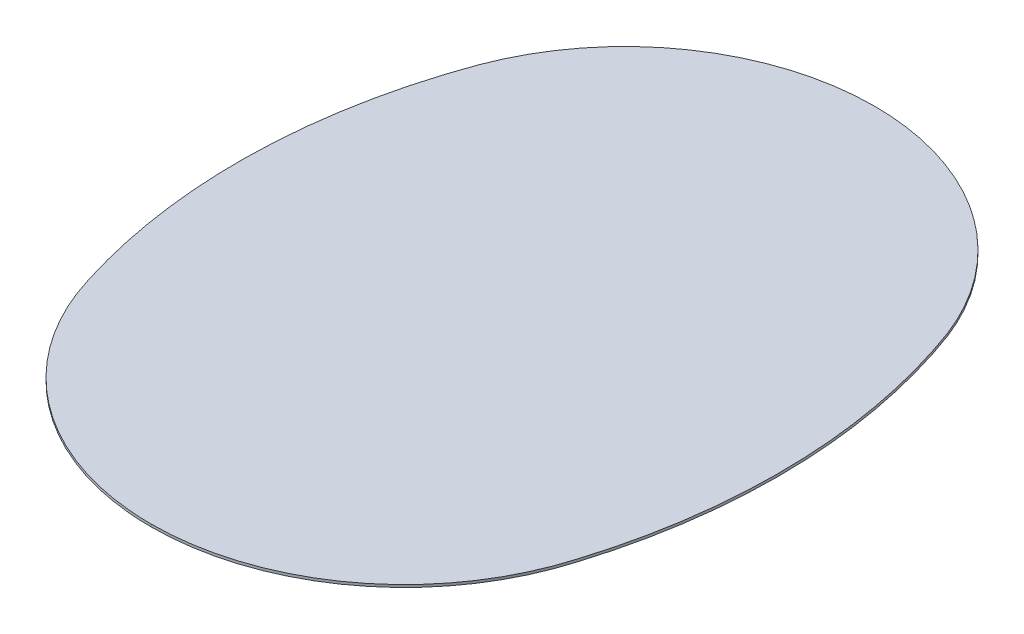
from build123d import *

# Parameters (mm, degrees)
BOSS_EXTRUDE1_START = -1
BOSS_EXTRUDE1_DEPTH = 1
SKETCH17_W          = 10
SKETCH17_H          = 20
BOSS_EXTRUDE2_DEPTH = 15
SKETCH18_R          = 17
SKETCH18_R_2        = 7.5
BOSS_EXTRUDE3_DEPTH = 10


with BuildPart() as part:
    # Boss-Extrude1: read off the stored shape, not the designer's step
    # Boss-Extrude1 outline → Boss-Extrude1 (new body)
    with BuildSketch(Plane(origin=(0, 0, 0), x_dir=(1, 0, 0), z_dir=(0, 1, 0)).offset(BOSS_EXTRUDE1_START)):
        with BuildLine():
            add(Edge.make_bspline(
                [(0, -220), (2.650276298, -220), (7.951145457, -219.788447576), (15.850522841, -218.840948256), (23.645097828, -217.267764836), (31.283817049, -215.083086873), (38.715627135, -212.301103927), (48.285761653, -207.825971636), (57.252877655, -202.24798423), (65.449297134, -195.690455108), (71.176050874, -190.319829495), (76.447031138, -184.534017199), (80.436821228, -179.40169448), (83.373307884, -175.13045468), (85.44559424, -171.850013734), (87.385396034, -168.498241408), (89.190307338, -165.080817418), (90.857922224, -161.60342148), (92.386918289, -158.071913425), (93.775973129, -154.492153085), (94.607833935, -152.077384555), (95.502390654, -149.309372342), (96.473023716, -146.194581533), (97.826951141, -141.506606451), (98.870557659, -137.587926901), (99.654854356, -134.446437316), (100.217835441, -132.087215717), (100.755627907, -129.725058268), (101.439170135, -126.571825285), (102.230890479, -122.623787239), (103.081045556, -117.877095165), (103.831713862, -113.122705164), (104.483317965, -108.361965725), (105.036078521, -103.596131518), (105.490216185, -98.826457214), (105.964530089, -92.463444239), (106.311968522, -84.506351129), (106.337933574, -74.96255373), (105.974702806, -65.433508026), (105.222799807, -55.929161229), (104.082748166, -46.459460547), (102.555071469, -37.034353193), (100.640293305, -27.663786375), (98.337585571, -18.358220791), (95.646120163, -9.128117138), (93.592086041, -3.031996454), (91.657037203, 2.34034693), (89.791763891, 6.960756036), (86.471331866, 13.66935036), (82.643898875, 20.114760275), (78.331681986, 26.258511476), (73.556898268, 32.062129655), (68.347753591, 37.490914489), (62.73245382, 42.51016565), (54.748705916, 48.616595292), (43.921852985, 55.076321875), (29.879582561, 60.756709253), (15.121141156, 64.223311553), (5.040349453, 65), (-5.040349453, 65), (-15.121141156, 64.223311553), (-29.879582561, 60.756709253), (-43.921852985, 55.076321875), (-54.748705916, 48.616595292), (-62.73245382, 42.51016565), (-68.347753591, 37.490914489), (-73.556898268, 32.062129655), (-78.331681986, 26.258511476), (-82.643898875, 20.114760275), (-86.471331866, 13.66935036), (-89.791763891, 6.960756036), (-91.657037203, 2.34034693), (-93.592086041, -3.031996454), (-95.646120163, -9.128117138), (-98.337585571, -18.358220791), (-100.640293305, -27.663786375), (-102.555071469, -37.034353193), (-104.082748166, -46.459460547), (-105.222799807, -55.929161229), (-105.974702806, -65.433508026), (-106.337933574, -74.96255373), (-106.311968522, -84.506351129), (-105.964530089, -92.463444239), (-105.490216185, -98.826457214), (-105.036078521, -103.596131518), (-104.483317965, -108.361965725), (-103.831713862, -113.122705164), (-103.081045556, -117.877095165), (-102.230890479, -122.623787239), (-101.439170135, -126.571825285), (-100.755627907, -129.725058268), (-100.217835441, -132.087215717), (-99.654854356, -134.446437316), (-98.870557659, -137.587926901), (-97.826951141, -141.506606451), (-96.473023716, -146.194581533), (-95.502390654, -149.309372342), (-94.607833935, -152.077384555), (-93.775973129, -154.492153085), (-92.386918289, -158.071913425), (-90.857922224, -161.60342148), (-89.190307338, -165.080817418), (-87.385396034, -168.498241408), (-85.44559424, -171.850013734), (-83.373307884, -175.13045468), (-80.436821228, -179.40169448), (-76.447031138, -184.534017199), (-71.176050874, -190.319829495), (-65.449297134, -195.690455108), (-57.252877655, -202.24798423), (-48.285761653, -207.825971636), (-38.715627135, -212.301103927), (-31.283817049, -215.083086873), (-23.645097828, -217.267764836), (-15.850522841, -218.840948256), (-7.951145457, -219.788447576), (-2.650276298, -220), (0, -220)],
                knots=[0, 0, 0, 0, 0.019113738, 0.038227475, 0.057341213, 0.076454951, 0.095568688, 0.114682426, 0.152909902, 0.172023639, 0.191137377, 0.210251115, 0.229364852, 0.238921721, 0.24847859, 0.258035459, 0.267592328, 0.277149197, 0.286706065, 0.296262934, 0.305819803, 0.305819803, 0.318062784, 0.330305765, 0.342548745, 0.348670236, 0.354791726, 0.360913217, 0.367034707, 0.379277688, 0.391520668, 0.403763649, 0.41600663, 0.428249611, 0.440492592, 0.452735572, 0.477221534, 0.501707495, 0.526193457, 0.550679418, 0.57516538, 0.599651342, 0.624137303, 0.648623265, 0.673109226, 0.697595188, 0.697595188, 0.716495488, 0.735395789, 0.75429609, 0.773196391, 0.792096692, 0.810996992, 0.829897293, 0.848797594, 0.886598195, 0.924398797, 0.962199398, 1, 1, 1.037800602, 1.075601203, 1.113401805, 1.151202406, 1.170102707, 1.189003008, 1.207903308, 1.226803609, 1.24570391, 1.264604211, 1.283504512, 1.302404812, 1.302404812, 1.326890774, 1.351376735, 1.375862697, 1.400348658, 1.42483462, 1.449320582, 1.473806543, 1.498292505, 1.522778466, 1.547264428, 1.559507408, 1.571750389, 1.58399337, 1.596236351, 1.608479332, 1.620722312, 1.632965293, 1.639086783, 1.645208274, 1.651329764, 1.657451255, 1.669694235, 1.681937216, 1.694180197, 1.694180197, 1.703737066, 1.713293935, 1.722850803, 1.732407672, 1.741964541, 1.75152141, 1.761078279, 1.770635148, 1.789748885, 1.808862623, 1.827976361, 1.847090098, 1.885317574, 1.904431312, 1.923545049, 1.942658787, 1.961772525, 1.980886262, 2, 2, 2, 2], degree=3))
        make_face()
    extrude(amount=BOSS_EXTRUDE1_DEPTH)

    # Sketch17 → Boss-Extrude2 (add)
    with BuildSketch(Plane(origin=(0, -1, 0), x_dir=(-1, 0, 0), z_dir=(0, -1, 0))):
        with Locations((0, -77.5)):
            Rectangle(SKETCH17_W, SKETCH17_H)
    extrude(amount=BOSS_EXTRUDE2_DEPTH)

    # Sketch18 → Boss-Extrude3 (add)
    with BuildSketch(Plane(origin=(5, 0, 0), x_dir=(0, 0, -1), z_dir=(1, 0, 0))):
        with Locations((-77.5, -29.452759073)):
            Circle(SKETCH18_R)
        with Locations((-77.5, -29.452759073)):
            Circle(SKETCH18_R_2, mode=Mode.SUBTRACT)
    extrude(amount=-BOSS_EXTRUDE3_DEPTH)


solid = part.part
